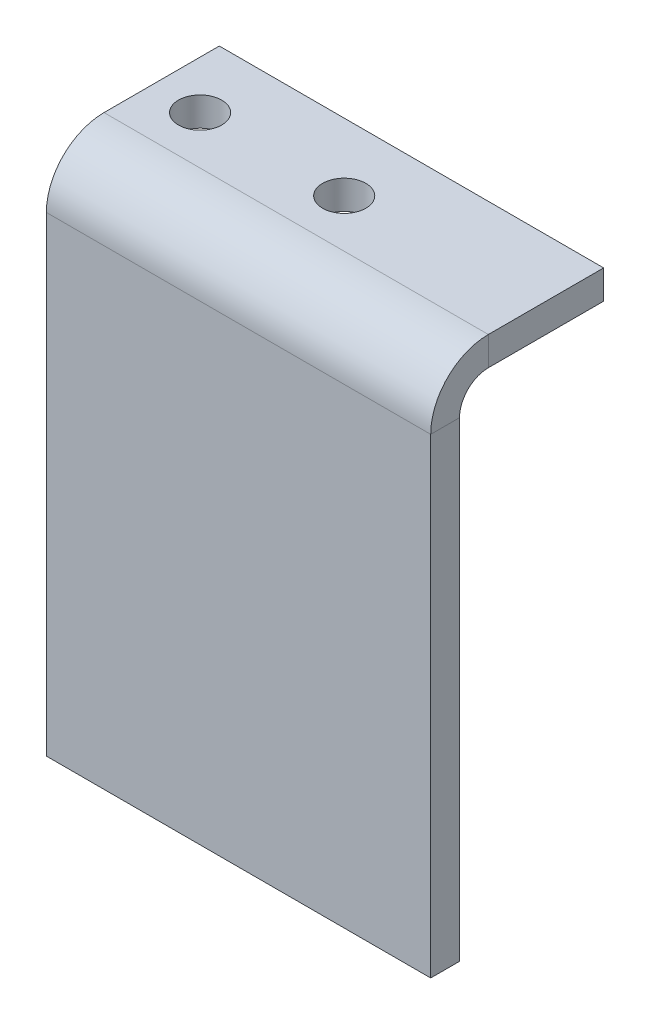
from build123d import *

# Parameters (mm, degrees)
SKETCH1_W                    = 40
SKETCH1_H                    = 55
BOSS_EXTRUDE1_DEPTH          = 2
CONVERT_SOLID1_START         = -20
CONVERT_SOLID1_OUTLINE_W     = 55
CONVERT_SOLID1_OUTLINE_H     = 1
CONVERT_SOLID1_DEPTH         = 40
EDGE_FLANGE1_STRIP_W         = 18
EDGE_FLANGE1_STRIP_H         = 3
EDGE_FLANGE1_STRIP_CUT_DEPTH = 40
EDGE_FLANGE1_DEPTH           = 40
SKETCH10_R                   = 2.25
CUT_EXTRUDE1_DEPTH           = 58.965506985


# Read off the part's stored shape, not the designer's step: Convert-Solid1
# Sheet-metal steps are written as plain solids
with BuildPart() as part:
    # Sketch1 → Boss-Extrude1 (new body)
    with BuildSketch(Plane.XY):
        Rectangle(SKETCH1_W, SKETCH1_H)
    extrude(amount=BOSS_EXTRUDE1_DEPTH)

    # Convert-Solid1 outline → Convert-Solid1 (add)
    with BuildSketch(Plane.YZ.offset(CONVERT_SOLID1_START)):
        with Locations((0, -0.5)):
            Rectangle(CONVERT_SOLID1_OUTLINE_W, CONVERT_SOLID1_OUTLINE_H)
    extrude(amount=CONVERT_SOLID1_DEPTH)

    # Edge-Flange1 strip (across the edge) → Edge-Flange1 strip cut (cut)
    with BuildSketch(Plane(origin=(-20, 27.5, -1), x_dir=(0, -1, 0), z_dir=(1, 0, 0))):
        with Locations((-3, -1.5)):
            Rectangle(EDGE_FLANGE1_STRIP_W, EDGE_FLANGE1_STRIP_H)
    extrude(amount=EDGE_FLANGE1_STRIP_CUT_DEPTH, mode=Mode.SUBTRACT)

    # Edge-Flange1 section (across the edge) → Edge-Flange1 (add)
    with BuildSketch(Plane(origin=(-20, 27.5, -1), x_dir=(0, -1, 0), z_dir=(1, 0, 0))):
        with BuildLine():
            Line((0, 3), (0, 15))
            Line((0, 15), (3, 15))
            Line((3, 15), (3, 3))
            ThreePointArc((3, 3), (3.878679656, 0.878679656), (6, 0))
            Line((6, 0), (6, -3))
            ThreePointArc((6, -3), (1.757359313, -1.242640687), (0, 3))
        make_face()
    extrude(amount=EDGE_FLANGE1_DEPTH)

    # Sketch10 → Cut-Extrude1 (cut, through all)
    with BuildSketch(Plane.XZ.offset(-24.5)):
        with Locations(Location((-15, -9, 0), (0, 0, 270))):
            Circle(SKETCH10_R)
        with Locations(Location((0, -9, 0), (0, 0, 270))):
            Circle(SKETCH10_R)
    extrude(amount=-CUT_EXTRUDE1_DEPTH, mode=Mode.SUBTRACT)


solid = part.part
